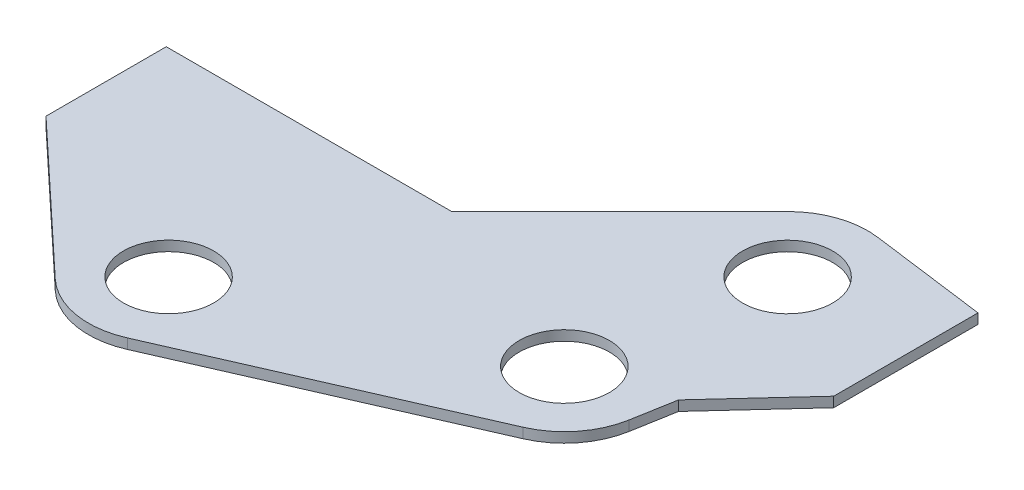
from build123d import *

# Parameters (mm, degrees)
SKETCH1_R           = 14.29004
BOSS_EXTRUDE1_DEPTH = 3.175


with BuildPart() as part:
    # Sketch1 → Boss-Extrude1 (new body)
    with BuildSketch(Plane(origin=(0, 0, 0), x_dir=(1, 0, 0), z_dir=(0, 1, 0))):
        with BuildLine():
            Line((-62.06952, -79.895280222), (25.163028109, -41.695780276))
            ThreePointArc((25.163028109, -41.695780276), (34.911191298, -34.148496119), (39.936134607, -22.890693115))
            Line((39.936134607, -22.890693115), (42.271095404, -9.586739751))
            Line((42.271095404, -9.586739751), (65.82695514, 16.012754812))
            Line((65.82695514, 16.012754812), (65.826833771, 61.726825209))
            Line((65.826833771, 61.726825209), (29.162987319, 66.591916163))
            ThreePointArc((29.162987319, 66.591916163), (17.671984848, 65.469640039), (7.864900148, 59.376715357))
            Line((7.864900148, 59.376715357), (-32.663625178, 18.864335762))
            Line((-32.663625178, 18.864335762), (-45.368686614, 6.164335762))
            Line((-45.368686614, 6.164335762), (-135.78566057, 6.164335762))
            Line((-135.78566057, 6.164335762), (-135.78566057, -31.935664238))
            Line((-135.78566057, -31.935664238), (-89.620113812, -75.16814328))
            ThreePointArc((-89.620113812, -75.16814328), (-76.553580444, -81.662511553), (-62.06952, -79.895280222))
        make_face()
        with Locations((25.821833771, 41.412625209)):
            Circle(SKETCH1_R, mode=Mode.SUBTRACT)
        with Locations((15.012562201, -18.516537909)):
            Circle(SKETCH1_R, mode=Mode.SUBTRACT)
        with Locations((-72.258332946, -56.628468385)):
            Circle(SKETCH1_R, mode=Mode.SUBTRACT)
    extrude(amount=BOSS_EXTRUDE1_DEPTH)


solid = part.part
